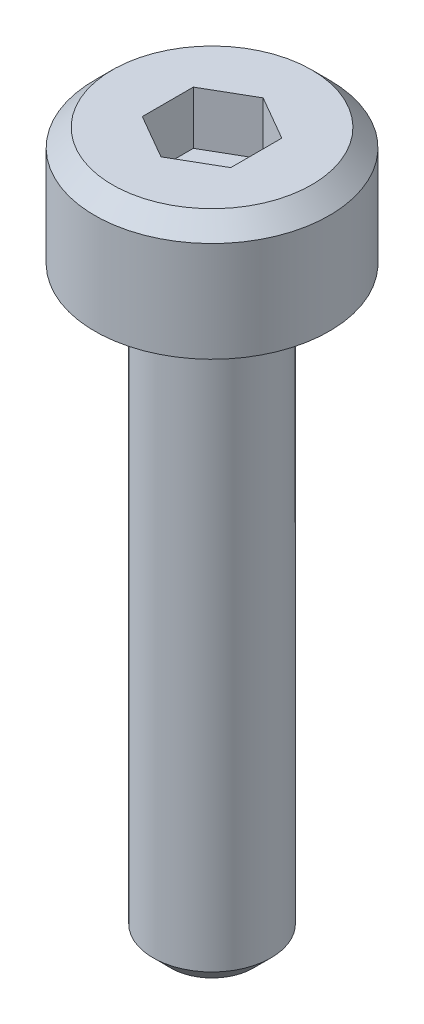
from build123d import *

# Parameters (mm, degrees)
CUT_EXTRUDE1_DEPTH = 0.9


with BuildPart() as part:
    # Sketch1 → Revolve1 (revolve)
    with BuildSketch(Plane.XY):
        Polygon((0, -10), (0.7, -10), (1, -9.7), (1, 0), (1.99, 0), (1.99, 1.7), (1.69, 2), (0, 2), align=None)
    revolve(axis=Axis((0, -10, 0), (0, 1, 0)))

    # Sketch2 → Cut-Extrude1 (cut)
    with BuildSketch(Plane(origin=(0, 2, 0), x_dir=(1, 0, 0), z_dir=(0, 1, 0))):
        Polygon((0.75, -0.433012702), (0, -0.866025404), (-0.75, -0.433012702), (-0.75, 0.433012702), (0, 0.866025404), (0.75, 0.433012702), align=None)
    extrude(amount=-CUT_EXTRUDE1_DEPTH, mode=Mode.SUBTRACT)


solid = part.part
